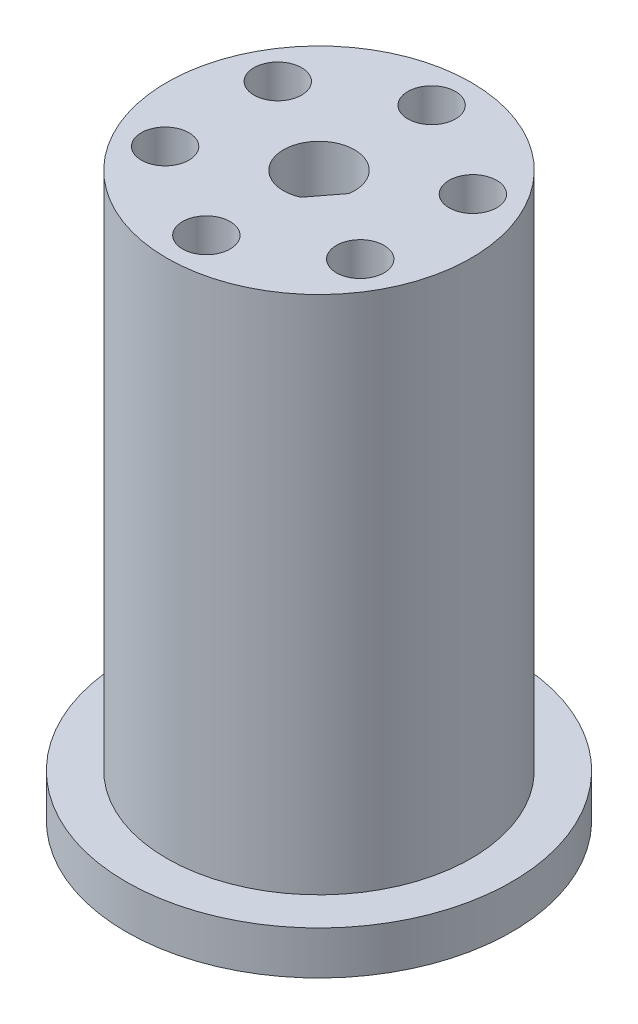
from build123d import *

# Parameters (mm, degrees)
SKETCH2_R           = 22.25
BOSS_EXTRUDE1_DEPTH = 5
SKETCH3_R           = 17.567
BOSS_EXTRUDE2_DEPTH = 60
SKETCH4_R           = 2.75
CUT_EXTRUDE1_DEPTH  = 73
SKETCH5_R           = 4.5
CUT_EXTRUDE2_DEPTH  = 5.5


with BuildPart() as part:
    # Sketch2 → Boss-Extrude1 (new body)
    with BuildSketch(Plane(origin=(0, 0, 0), x_dir=(1, 0, 0), z_dir=(0, 1, 0))):
        Circle(SKETCH2_R)
    extrude(amount=BOSS_EXTRUDE1_DEPTH)

    # Sketch3 → Boss-Extrude2 (add)
    with BuildSketch(Plane(origin=(0, 5, 0), x_dir=(1, 0, 0), z_dir=(0, 1, 0))):
        Circle(SKETCH3_R)
    extrude(amount=BOSS_EXTRUDE2_DEPTH)

    # Sketch4 → Cut-Extrude1 (cut)
    with BuildSketch(Plane(origin=(0, 65, 0), x_dir=(1, 0, 0), z_dir=(0, 1, 0))):
        with Locations((0, 13)):
            Circle(SKETCH4_R)
        with Locations((-11.258330249, 6.5)):
            Circle(SKETCH4_R)
        with Locations((-11.258330249, -6.5)):
            Circle(SKETCH4_R)
        with Locations((0, -13)):
            Circle(SKETCH4_R)
        with Locations((11.258330249, -6.5)):
            Circle(SKETCH4_R)
        with Locations((11.258330249, 6.5)):
            Circle(SKETCH4_R)
        with BuildLine():
            Line((4.055242224, -0.604160991), (1.701340652, -3.679733684))
            Line((1.701340652, -3.679733684), (1.642493113, -3.756623001))
            ThreePointArc((1.642493113, -3.756623001), (-3.255848764, 2.491876567), (4.055242224, -0.604160991))
        make_face()
    extrude(amount=-CUT_EXTRUDE1_DEPTH, mode=Mode.SUBTRACT)

    # Sketch5 → Cut-Extrude2 (cut)
    with BuildSketch(Plane.XZ):
        with Locations((0, 13)):
            Circle(SKETCH5_R)
        with Locations((11.258330249, 6.5)):
            Circle(SKETCH5_R)
        with Locations((11.258330249, -6.5)):
            Circle(SKETCH5_R)
        with Locations((0, -13)):
            Circle(SKETCH5_R)
        with Locations((-11.258330249, -6.5)):
            Circle(SKETCH5_R)
        with Locations((-11.258330249, 6.5)):
            Circle(SKETCH5_R)
    extrude(amount=-CUT_EXTRUDE2_DEPTH, mode=Mode.SUBTRACT)


solid = part.part
